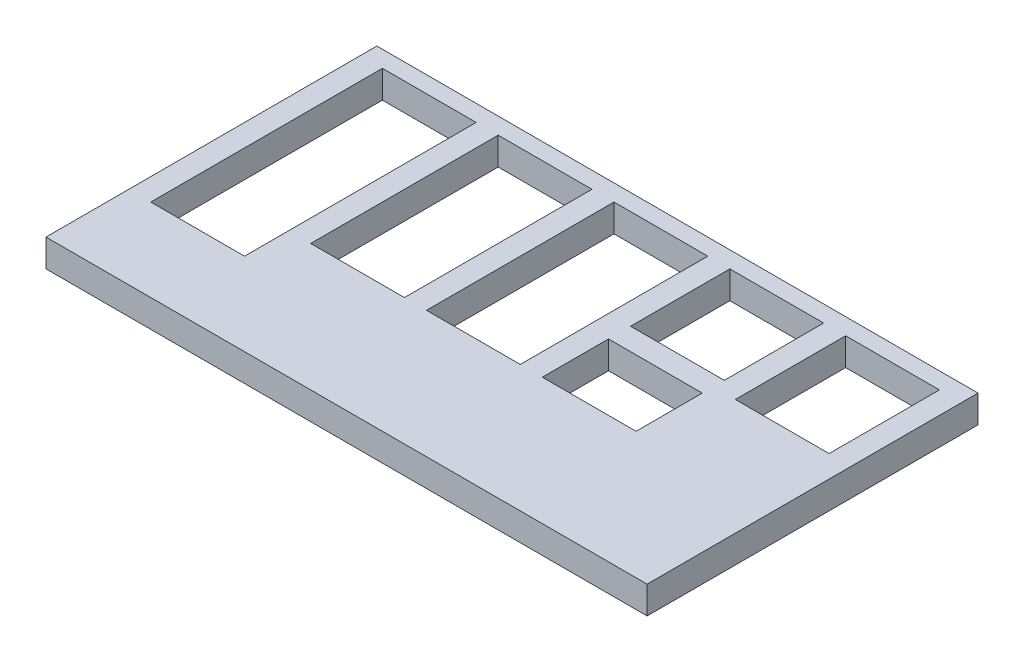
from build123d import *

# Parameters (mm, degrees)
SKETCH1_W           = 109
SKETCH1_H           = 60
SKETCH1_W_2         = 17
SKETCH1_H_2         = 12
SKETCH1_H_3         = 42
SKETCH1_H_4         = 34
SKETCH1_H_5         = 18
SKETCH1_H_6         = 20
BOSS_EXTRUDE1_DEPTH = 5


with BuildPart() as part:
    # Sketch1 → Boss-Extrude1 (new body)
    with BuildSketch(Plane(origin=(0, 0, 0), x_dir=(1, 0, 0), z_dir=(0, 1, 0))):
        Rectangle(SKETCH1_W, SKETCH1_H)
        with Locations((21, -1)):
            Rectangle(SKETCH1_W_2, SKETCH1_H_2, mode=Mode.SUBTRACT)
        with Locations((-42, 6)):
            Rectangle(SKETCH1_W_2, SKETCH1_H_3, mode=Mode.SUBTRACT)
        with Locations((-21, 10)):
            Rectangle(SKETCH1_W_2, SKETCH1_H_4, mode=Mode.SUBTRACT)
        with Locations((0, 10)):
            Rectangle(SKETCH1_W_2, SKETCH1_H_4, mode=Mode.SUBTRACT)
        with Locations((21, 18)):
            Rectangle(SKETCH1_W_2, SKETCH1_H_5, mode=Mode.SUBTRACT)
        with Locations((42, 17)):
            Rectangle(SKETCH1_W_2, SKETCH1_H_6, mode=Mode.SUBTRACT)
    extrude(amount=BOSS_EXTRUDE1_DEPTH)


solid = part.part
